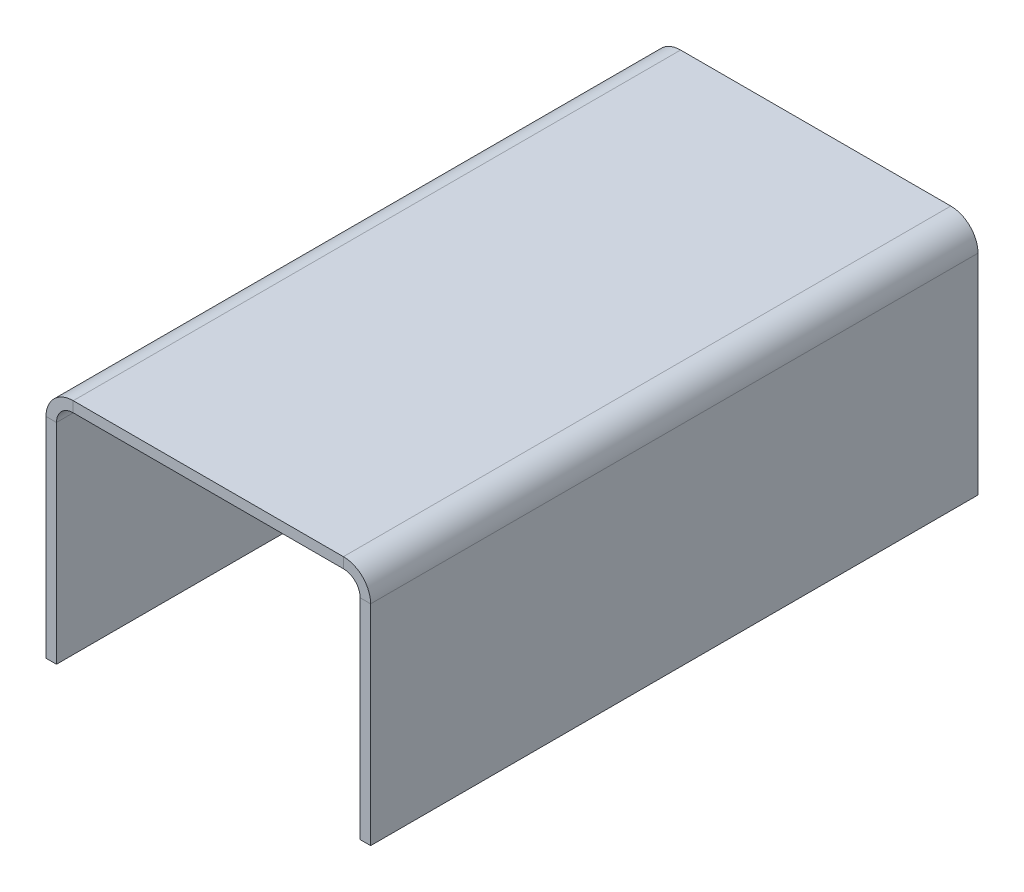
from build123d import *

# Parameters (mm, degrees)
SKETCH1_W                      = 155
SKETCH1_H                      = 290
BASE_FLANGE1_DEPTH             = 5
EDGE_FLANGE1_STRIP_W           = 36
EDGE_FLANGE1_STRIP_H           = 5
EDGE_FLANGE1_STRIP_CUT_DEPTH   = 290
EDGE_FLANGE1_STRIP_2_W         = 36
EDGE_FLANGE1_STRIP_2_H         = 5
EDGE_FLANGE1_STRIP_CUT_2_DEPTH = 290
EDGE_FLANGE1_DEPTH             = 290
EDGE_FLANGE1_BEND_DEPTH        = 290


# Sheet-metal steps are written as plain solids
with BuildPart() as part:
    # Sketch1 → Base-Flange1 (new body)
    with BuildSketch(Plane(origin=(0, 0, 0), x_dir=(1, 0, 0), z_dir=(0, 1, 0))):
        Rectangle(SKETCH1_W, SKETCH1_H)
    extrude(amount=-BASE_FLANGE1_DEPTH)

    # Edge-Flange1 strip (across the edge) → Edge-Flange1 strip cut (cut)
    with BuildSketch(Plane(origin=(77.5, -5, -145), x_dir=(-1, 0, 0), z_dir=(0, 0, 1))):
        with Locations((-5, -2.5)):
            Rectangle(EDGE_FLANGE1_STRIP_W, EDGE_FLANGE1_STRIP_H)
    extrude(amount=EDGE_FLANGE1_STRIP_CUT_DEPTH, mode=Mode.SUBTRACT)

    # Edge-Flange1 strip 2 (across the edge) → Edge-Flange1 strip cut 2 (cut)
    with BuildSketch(Plane(origin=(-77.5, -5, 145), x_dir=(1, 0, 0), z_dir=(0, 0, -1))):
        with Locations((-5, -2.5)):
            Rectangle(EDGE_FLANGE1_STRIP_2_W, EDGE_FLANGE1_STRIP_2_H)
    extrude(amount=EDGE_FLANGE1_STRIP_CUT_2_DEPTH, mode=Mode.SUBTRACT)

    # Edge-Flange1 section (across the edge) → Edge-Flange1 (add)
    with BuildSketch(Plane(origin=(77.5, -5, -145), x_dir=(-1, 0, 0), z_dir=(0, 0, 1))):
        with BuildLine():
            Line((0, 8), (0, 108))
            Line((0, 108), (5, 108))
            Line((5, 108), (5, 8))
            ThreePointArc((5, 8), (7.343145751, 2.343145751), (13, 0))
            Line((13, 0), (13, -5))
            ThreePointArc((13, -5), (3.807611845, -1.192388155), (0, 8))
        make_face()
    extrude(amount=EDGE_FLANGE1_DEPTH)

    # Edge-Flange1 section 2 (across the edge) → Edge-Flange1 bend (add)
    with BuildSketch(Plane(origin=(-77.5, -5, 145), x_dir=(1, 0, 0), z_dir=(0, 0, -1))):
        with BuildLine():
            Line((0, 8), (0, 108))
            Line((0, 108), (5, 108))
            Line((5, 108), (5, 8))
            ThreePointArc((5, 8), (7.343145751, 2.343145751), (13, 0))
            Line((13, 0), (13, -5))
            ThreePointArc((13, -5), (3.807611845, -1.192388155), (0, 8))
        make_face()
    extrude(amount=EDGE_FLANGE1_BEND_DEPTH)


solid = part.part
